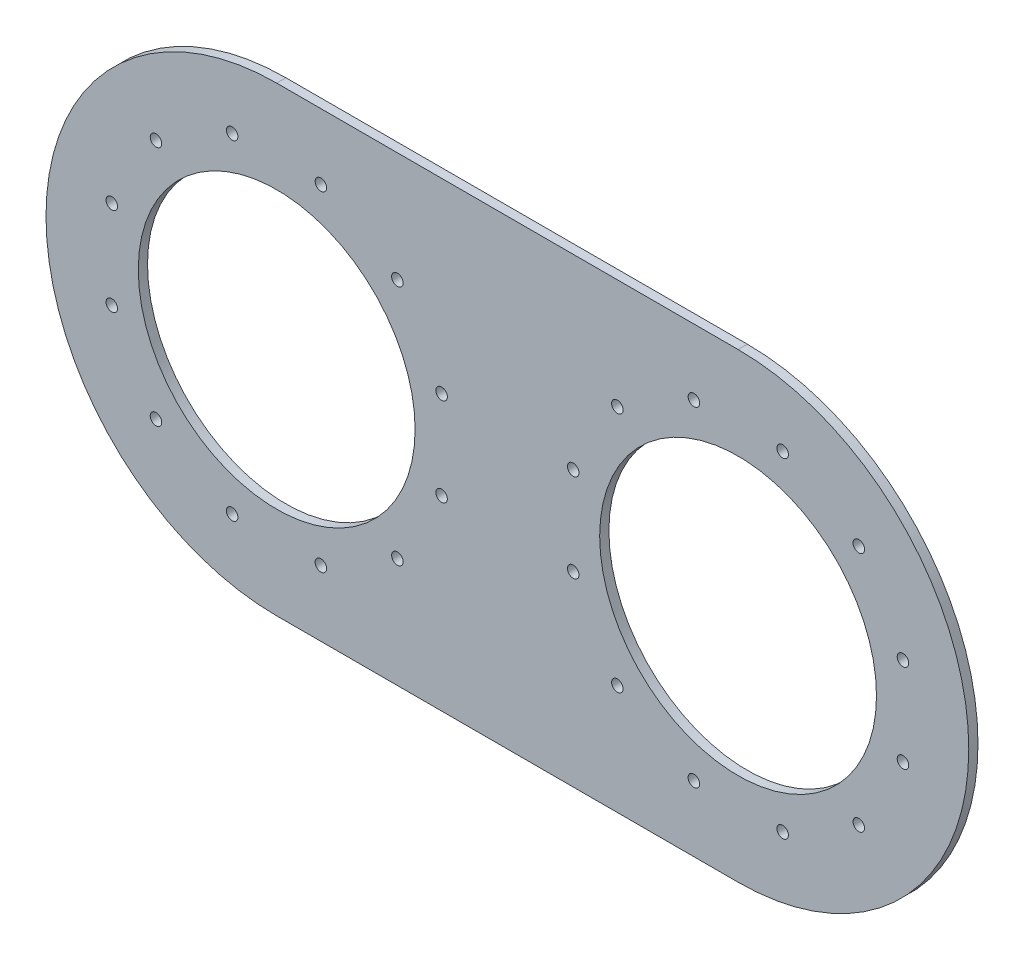
from build123d import *

# Parameters (mm, degrees)
SKETCH_1_R         = 30
EXTRUDE_1_DEPTH    = 2
HOLE_WIZARD_M3_1_D = 2.5


with BuildPart() as part:
    # 草图1 → 凸台-拉伸1 (new body)
    with BuildSketch(Plane.XY):
        with BuildLine():
            Line((-50, 50), (50, 50))
            ThreePointArc((50, 50), (100, 0), (50, -50))
            Line((50, -50), (-50, -50))
            ThreePointArc((-50, -50), (-100, 0), (-50, 50))
        make_face()
        with Locations((-50, 0)):
            Circle(SKETCH_1_R, mode=Mode.SUBTRACT)
        with Locations((50, 0)):
            Circle(SKETCH_1_R, mode=Mode.SUBTRACT)
    extrude(amount=EXTRUDE_1_DEPTH)

    # M3 螺纹孔的螺纹孔钻头1 (through all)
    with Locations(Plane(origin=(-40.423695331, 35.739255573, 2), x_dir=(1, 0, 0), z_dir=(0, 0, 1))):
        with Locations((0, 0), (16.586646235, -9.576304669), (26.162950904, -26.162950904), (-19.23309471, -0.021663184), (-35.739255573, -9.576304669), (-45.315560242, -26.162950904), (126.162950904, -26.162950904), (116.586646235, -9.576304669), (100.080485372, -0.021663184), (54.684439758, -26.162950904), (64.260744427, -9.576304669), (80.847390662, 0), (80.847390662, -71.478511146), (64.260744427, -61.902206477), (54.684439758, -45.315560242), (100.080485372, -71.456847962), (116.586646235, -61.902206477), (126.162950904, -45.315560242), (-45.315560242, -45.315560242), (-35.739255573, -61.902206477), (-19.23309471, -71.456847962), (26.162950904, -45.315560242), (16.586646235, -61.902206477), (0, -71.478511146)):
            Hole(HOLE_WIZARD_M3_1_D / 2)


solid = part.part
